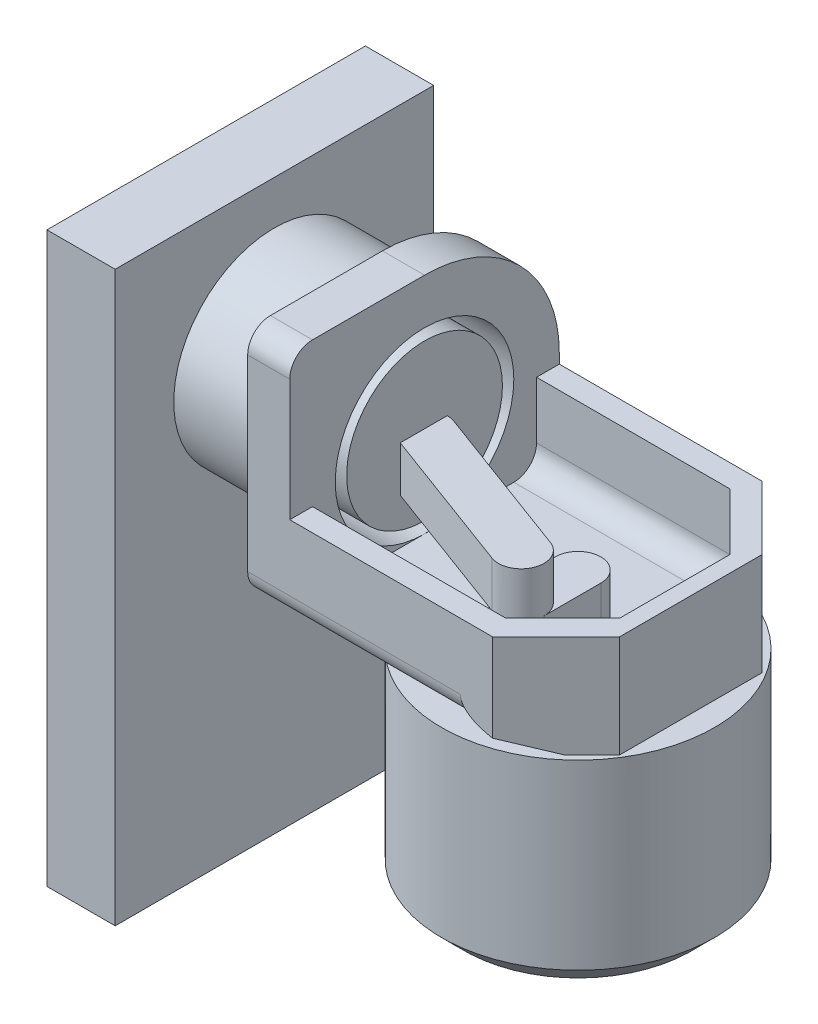
from build123d import *

# Parameters (mm, degrees)
SKETCH1_W               = 28
SKETCH1_H               = 50
SKETCH1_R               = 5.5
BOSS_EXTRUDE1_DEPTH     = 6
SKETCH2_R               = 8.85
SKETCH2_R_2             = 7.85
BOSS_EXTRUDE2_DEPTH     = 9.5
SKETCH3_R               = 7.85
BOSS_EXTRUDE3_DEPTH     = 3.7
BOSS_EXTRUDE4_DEPTH     = 22
CHAMFER1_SIZE           = 7
BOSS_EXTRUDE5_DEPTH     = 2
BOSS_EXTRUDE6_DEPTH     = 2
BOSS_EXTRUDE7_DEPTH     = 9
CUT_EXTRUDE1_DEPTH      = 63.678335221
CUT_EXTRUDE1_DEPTH_BACK = 63.678335221
BOSS_EXTRUDE8_DEPTH     = 4
BOSS_EXTRUDE9_DEPTH     = 4
SKETCH12_R              = 6.85
BOSS_EXTRUDE10_DEPTH    = 4
SKETCH13_R              = 12
BOSS_EXTRUDE11_DEPTH    = 18
CHAMFER2_SIZE           = 2


with BuildPart() as part:
    # Sketch1 → Boss-Extrude1 (new body)
    with BuildSketch(Plane(origin=(0, 0, 0), x_dir=(0, 0, -1), z_dir=(1, 0, 0))):
        with Locations((14, -25)):
            Rectangle(SKETCH1_W, SKETCH1_H)
        with Locations((14, -12.7)):
            Circle(SKETCH1_R, mode=Mode.SUBTRACT)
    extrude(amount=BOSS_EXTRUDE1_DEPTH)

    # Sketch2 → Boss-Extrude2 (add)
    with BuildSketch(Plane(origin=(6, 0, 0), x_dir=(0, 0, -1), z_dir=(1, 0, 0))):
        with Locations((14, -12.7)):
            Circle(SKETCH2_R)
        with Locations((14, -12.7)):
            Circle(SKETCH2_R_2, mode=Mode.SUBTRACT)
    extrude(amount=BOSS_EXTRUDE2_DEPTH)

    # Sketch3 → Boss-Extrude3 (add)
    with BuildSketch(Plane(origin=(15.5, 0, 0), x_dir=(0, 0, -1), z_dir=(1, 0, 0))):
        with BuildLine():
            Line((2.15, -12.7), (2.15, -2.85))
            ThreePointArc((2.15, -2.85), (2.735786438, -1.435786438), (4.15, -0.85))
            Line((4.15, -0.85), (14, -0.85))
            ThreePointArc((14, -0.85), (22.379215357, -4.320784643), (25.85, -12.7))
            Line((25.85, -12.7), (25.85, -22.55))
            ThreePointArc((25.85, -22.55), (25.264213562, -23.964213562), (23.85, -24.55))
            Line((23.85, -24.55), (14, -24.55))
            ThreePointArc((14, -24.55), (11.74368498, -24.333208609), (9.569926867, -23.690766672))
            Line((9.569926867, -23.690766672), (3.402308332, -21.204770746))
            ThreePointArc((3.402308332, -21.204770746), (2.492383739, -20.46885486), (2.15, -19.34978903))
            Line((2.15, -19.34978903), (2.15, -12.7))
        make_face()
        with Locations((14, -12.7)):
            Circle(SKETCH3_R, mode=Mode.SUBTRACT)
    extrude(amount=BOSS_EXTRUDE3_DEPTH)

    # Sketch4 → Boss-Extrude4 (add)
    with BuildSketch(Plane(origin=(19.2, 0, 0), x_dir=(0, 0, -1), z_dir=(1, 0, 0))):
        with BuildLine():
            Line((21.85, -20.55), (6.15, -20.55))
            ThreePointArc((6.15, -20.55), (4.735786438, -19.964213562), (4.15, -18.55))
            Line((4.15, -18.55), (4.15, -13.55))
            Line((4.15, -13.55), (2.15, -13.55))
            Line((2.15, -13.55), (2.15, -19.34978903))
            ThreePointArc((2.15, -19.34978903), (2.252675107, -19.982369656), (2.55015825, -20.55))
            ThreePointArc((2.55015825, -20.55), (2.931431385, -20.935692725), (3.402308332, -21.204770746))
            Line((3.402308332, -21.204770746), (6.739747784, -22.55))
            Line((6.739747784, -22.55), (25.85, -22.55))
            Line((25.85, -22.55), (25.85, -20.55))
            Line((25.85, -20.55), (25.85, -13.55))
            Line((25.85, -13.55), (23.85, -13.55))
            Line((23.85, -13.55), (23.85, -18.55))
            ThreePointArc((23.85, -18.55), (23.264213562, -19.964213562), (21.85, -20.55))
        make_face()
    extrude(amount=BOSS_EXTRUDE4_DEPTH)

    # Chamfer1
    # the kernel refuses this chamfer: 7 mm, written as the material it takes off along each edge
    with BuildSketch(Plane(origin=(41.2, 4.451780916, -25.85), x_dir=(0.027495876610586112, 0, 0.9996219169112968), z_dir=(0, -1, 0))) as chamfer1_piece_1:
        Polygon((CHAMFER1_SIZE * 0.999621916911, CHAMFER1_SIZE * 0.0274958766106), (-CHAMFER1_SIZE * 0.0274958766106, CHAMFER1_SIZE * 0.999621916911), (0, 0), align=None)
    extrude(amount=45.003561832, mode=Mode.SUBTRACT)
    with BuildSketch(Plane(origin=(41.2, 4.451780916, -2.15), x_dir=(0.02749587661058612, 0, -0.9996219169112968), z_dir=(0, -1, 0))) as chamfer1_piece_2:
        Polygon((CHAMFER1_SIZE * 0.999621916911, -CHAMFER1_SIZE * 0.0274958766106), (-CHAMFER1_SIZE * 0.0274958766106, -CHAMFER1_SIZE * 0.999621916911), (0, 0), align=None)
    extrude(amount=41.803350861, mode=Mode.SUBTRACT)

    # Sketch6 → Boss-Extrude5 (add)
    with BuildSketch(Plane(origin=(16.025, 0, 16.025), x_dir=(0.7071067811865438, 0, -0.7071067811865512), z_dir=(0.7071067811865512, 0, 0.7071067811865438))):
        with BuildLine():
            Line((28.531758621, -13.55), (35.602826433, -13.55))
            Line((35.602826433, -13.55), (35.602826433, -20.55))
            Line((35.602826433, -20.55), (35.602826433, -22.55))
            Line((35.602826433, -22.55), (32.19421506, -22.55))
            Line((32.19421506, -22.55), (27.474362924, -21.204770746))
            add(Edge.make_bspline(
                [(25.703331496, -19.34978903), (25.703331496, -20.7), (27.474362924, -21.204770746)],
                knots=[0, 0, 0, 1.187644261, 1.187644261, 1.187644261], degree=2, weights=[1, 0.82880813, 1]))
            Line((25.703331496, -19.34978903), (25.703331496, -13.55))
            Line((25.703331496, -13.55), (28.531758621, -13.55))
        make_face()
    extrude(amount=BOSS_EXTRUDE5_DEPTH)

    # Sketch7 → Boss-Extrude6 (add)
    with BuildSketch(Plane(origin=(30.025, 0, -30.025), x_dir=(-0.7071067811865438, 0, -0.7071067811865512), z_dir=(0.7071067811865512, 0, -0.7071067811865438))):
        Polygon((-15.80383656, -20.55), (-15.80383656, -13.55), (-8.732768748, -13.55), (-5.904341623, -13.55), (-5.904341623, -22.55), (-15.80383656, -22.55), align=None)
    extrude(amount=BOSS_EXTRUDE6_DEPTH)

    # Sketch8 → Boss-Extrude7 (add)
    with BuildSketch(Plane(origin=(0, -13.55, 0), x_dir=(1, 0, 0), z_dir=(0, 1, 0))):
        Polygon((41.2, 18.85), (41.2, 9.15), (42.614213562, 7.735786438), (42.614213562, 20.264213562), align=None)
    extrude(amount=-BOSS_EXTRUDE7_DEPTH)

    # Sketch9 → Cut-Extrude1 (cut, two sides: drawn at the far end of the back side and taken through both)
    with BuildSketch(Plane(origin=(0, -13.55, 0), x_dir=(1, 0, 0), z_dir=(0, 1, 0)).offset(-CUT_EXTRUDE1_DEPTH_BACK)):
        Polygon((34.2, 2.15), (37.028427125, 2.15), (35.614213562, 0.735786438), align=None)
        Polygon((34.2, 25.85), (37.028427125, 25.85), (35.614213562, 27.264213562), align=None)
    extrude(amount=CUT_EXTRUDE1_DEPTH + CUT_EXTRUDE1_DEPTH_BACK, mode=Mode.SUBTRACT)

    # Sketch10 → Boss-Extrude8 (add)
    with BuildSketch(Plane(origin=(0, -20.55, 0), x_dir=(1, 0, 0), z_dir=(0, 1, 0))):
        with BuildLine():
            Line((34.7, 14), (34.7, 9))
            ThreePointArc((34.7, 9), (32.7, 7), (30.7, 9))
            Line((30.7, 9), (30.7, 14))
            ThreePointArc((30.7, 14), (32.7, 16), (34.7, 14))
        make_face()
    extrude(amount=BOSS_EXTRUDE8_DEPTH)

    # Sketch11 → Boss-Extrude9 (add)
    with BuildSketch(Plane(origin=(0, -16.55, 0), x_dir=(1, 0, 0), z_dir=(0, 1, 0))):
        with BuildLine():
            Line((18.505371288, 12.124502479), (32.005371288, 7.124502479))
            ThreePointArc((32.005371288, 7.124502479), (34.575497521, 8.305371288), (33.394628712, 10.875497521))
            Line((33.394628712, 10.875497521), (19.894628712, 15.875497521))
            ThreePointArc((19.894628712, 15.875497521), (17.324502479, 14.694628712), (18.505371288, 12.124502479))
        make_face()
    extrude(amount=BOSS_EXTRUDE9_DEPTH)

    # Sketch12 → Boss-Extrude10 (add)
    with BuildSketch(Plane(origin=(19.2, 0, 0), x_dir=(0, 0, -1), z_dir=(1, 0, 0))):
        with Locations((14, -12.7)):
            Circle(SKETCH12_R)
    extrude(amount=-BOSS_EXTRUDE10_DEPTH)

    # Sketch13 → Boss-Extrude11 (add)
    with BuildSketch(Plane.XZ.offset(22.55)):
        with Locations(Location((32.7, -14, 0), (0, 0, 142.769645669))):
            Circle(SKETCH13_R)
    extrude(amount=BOSS_EXTRUDE11_DEPTH)

    # Chamfer2
    chamfer2_edges = [part.edges().sort_by_distance(p)[0] for p in [
        (42.254513999, -40.55, -21.260252216),
    ]]
    chamfer(chamfer2_edges, length=CHAMFER2_SIZE)


solid = part.part
